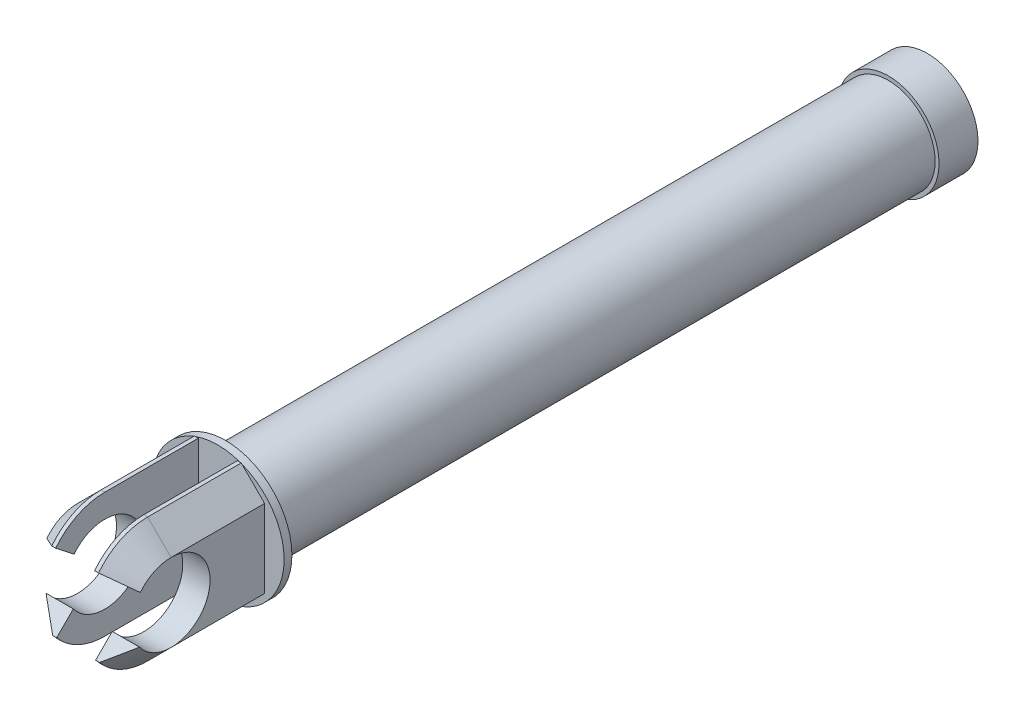
from build123d import *

# Parameters (mm, degrees)
SKETCH1_R           = 13
SKETCH1_R_2         = 12
BOSS_EXTRUDE1_DEPTH = 10
SKETCH2_R           = 12
BOSS_EXTRUDE2_DEPTH = 170
SKETCH3_R           = 17
BOSS_EXTRUDE3_DEPTH = 2
SKETCH4_R           = 10
BOSS_EXTRUDE4_DEPTH = 12
CHAMFER1_SIZE       = 6
SKETCH5_W           = 10
SKETCH5_H           = 41
CUT_EXTRUDE1_DEPTH  = 20
CUT_EXTRUDE2_REACH  = 226.531


with BuildPart() as part:
    # Sketch1 → Boss-Extrude1 (new body)
    # profile 1 of 2: a face of its own
    with BuildSketch(Plane.XY):
        Circle(SKETCH1_R)
        Circle(SKETCH1_R_2, mode=Mode.SUBTRACT)
    # profile 2 of 2: a face of its own
    with BuildSketch(Plane.XY):
        Circle(SKETCH1_R_2)
    extrude(amount=BOSS_EXTRUDE1_DEPTH)

    # Sketch2 → Boss-Extrude2 (add)
    with BuildSketch(Plane.XY.offset(10)):
        Circle(SKETCH2_R)
    extrude(amount=BOSS_EXTRUDE2_DEPTH)

    # Sketch3 → Boss-Extrude3 (add)
    with BuildSketch(Plane.XY.offset(180)):
        Circle(SKETCH3_R)
    extrude(amount=BOSS_EXTRUDE3_DEPTH)

    # Sketch4 → Boss-Extrude4 (add, symmetric)
    with BuildSketch(Plane(origin=(0, 0, 0), x_dir=(0, 0, -1), z_dir=(1, 0, 0))):
        with BuildLine():
            Line((-182, 16), (-206, 16))
            ThreePointArc((-206, 16), (-222, 0), (-206, -16))
            Line((-206, -16), (-182, -16))
            Line((-182, -16), (-182, 16))
        make_face()
        with Locations((-206, 0)):
            Circle(SKETCH4_R, mode=Mode.SUBTRACT)
    extrude(amount=BOSS_EXTRUDE4_DEPTH, both=True)

    # Chamfer1
    # the kernel refuses this chamfer: 6 mm, written as the material it takes off along each edge
    with BuildSketch(Plane(origin=(12, 16, 182), x_dir=(0.027495876610586487, -0.9996219169112968, 0), z_dir=(0, 0, 1)), Plane(origin=(12, -16, 206), x_dir=(0.027495876610586487, 0.9996219169112968, 0), z_dir=(0, 0, -1)), Plane(origin=(-12, -16, 206), x_dir=(0.9996219169112968, -0.027495876610586202, 0), z_dir=(0, 0, -1))) as chamfer1_piece_1:
        Polygon((CHAMFER1_SIZE * 0.999621916911, -CHAMFER1_SIZE * 0.0274958766106), (-CHAMFER1_SIZE * 0.0274958766106, -CHAMFER1_SIZE * 0.999621916911), (0, 0), align=None)
    extrude(amount=24, mode=Mode.SUBTRACT)
    with BuildSketch(Plane(origin=(12, 0, 206), x_dir=(0, 1, 0), z_dir=(0, 0, -1))) as chamfer1_piece_2:
        Polygon((16 - CHAMFER1_SIZE, 0), (16, -CHAMFER1_SIZE), (16, 0), align=None)
    revolve(axis=Axis((12, 0, 206), (1, 0, 0)), revolution_arc=180, mode=Mode.SUBTRACT)
    with BuildSketch(Plane(origin=(-12, 16, 182), x_dir=(-0.027495876610586487, -0.9996219169112968, 0), z_dir=(0, 0, 1))) as chamfer1_piece_3:
        Polygon((CHAMFER1_SIZE * 0.999621916911, CHAMFER1_SIZE * 0.0274958766106), (-CHAMFER1_SIZE * 0.0274958766106, CHAMFER1_SIZE * 0.999621916911), (0, 0), align=None)
    extrude(amount=24, mode=Mode.SUBTRACT)
    with BuildSketch(Plane(origin=(-12, 0, 206), x_dir=(0, 1, 0), z_dir=(0, 0, -1))) as chamfer1_piece_4:
        Polygon((16 - CHAMFER1_SIZE, 0), (16, CHAMFER1_SIZE), (16, 0), align=None)
    revolve(axis=Axis((-12, 0, 206), (1, 0, 0)), revolution_arc=180, mode=Mode.SUBTRACT)

    # Sketch5 → Cut-Extrude1 (cut, symmetric)
    with BuildSketch(Plane(origin=(0, 0, 0), x_dir=(1, 0, 0), z_dir=(0, 1, 0))):
        with Locations((0, -202.5)):
            Rectangle(SKETCH5_W, SKETCH5_H)
    extrude(amount=CUT_EXTRUDE1_DEPTH, both=True, mode=Mode.SUBTRACT)

    # Cut-Extrude2: up to this face of the body (flat: up to its plane)
    cut_extrude2_end = Plane(part.part.faces().sort_by_distance((-12, 0, 190.227277531))[0])
    # Sketch6 → Cut-Extrude2 (cut, up to the picked face)
    with BuildSketch(Plane(origin=(12, 0, 0), x_dir=(0, 0, -1), z_dir=(1, 0, 0)), mode=Mode.PRIVATE) as cut_extrude2_sk1:
        with BuildLine():
            Line((-218.605812772, 9.853602608), (-213.878632982, 6.15850163))
            ThreePointArc((-213.878632982, 6.15850163), (-215.998555894, 0.169941286), (-214.083368787, -5.887202141))
            Line((-214.083368787, -5.887202141), (-218.35837697, -10.162210324))
            ThreePointArc((-218.35837697, -10.162210324), (-221.998777585, -0.197777146), (-218.605812772, 9.853602608))
        make_face()
    cut_extrude2_tool1 = split(extrude(cut_extrude2_sk1.sketch, amount=-CUT_EXTRUDE2_REACH, mode=Mode.PRIVATE), bisect_by=cut_extrude2_end, keep=Keep.BOTH, mode=Mode.PRIVATE)
    add(cut_extrude2_tool1.solids().sort_by(Axis((12, -0.027254, 218.293854), (-1, 0, 0)))[0], mode=Mode.SUBTRACT)


solid = part.part
